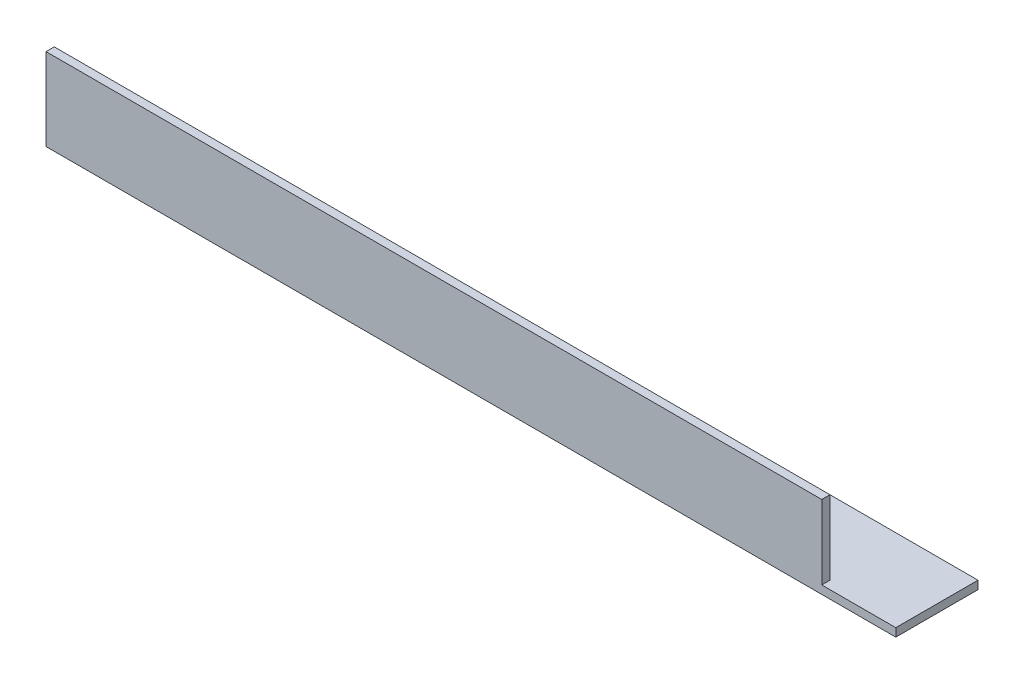
from build123d import *

# Parameters (mm, degrees)
EXTRUDE_1_DEPTH     = 310
SKETCH_2_W          = 27
SKETCH_2_H          = 27
CUT_EXTRUDE_1_DEPTH = 313.889756943


with BuildPart() as part:
    # Эскиз1 → Вытянуть-Тонкостенный1 (new body)
    with BuildSketch(Plane(origin=(0, 0, 0), x_dir=(0, 0, -1), z_dir=(1, 0, 0))):
        Polygon((0, 30), (0, 0), (30, 0), (30, 3), (3, 3), (3, 30), align=None)
    extrude(amount=EXTRUDE_1_DEPTH)

    # Эскиз2 → Вырез-Вытянуть1 (cut, through all)
    with BuildSketch(Plane.XY):
        with Locations((296.5, 16.5)):
            Rectangle(SKETCH_2_W, SKETCH_2_H)
    extrude(amount=-CUT_EXTRUDE_1_DEPTH, mode=Mode.SUBTRACT)


solid = part.part
